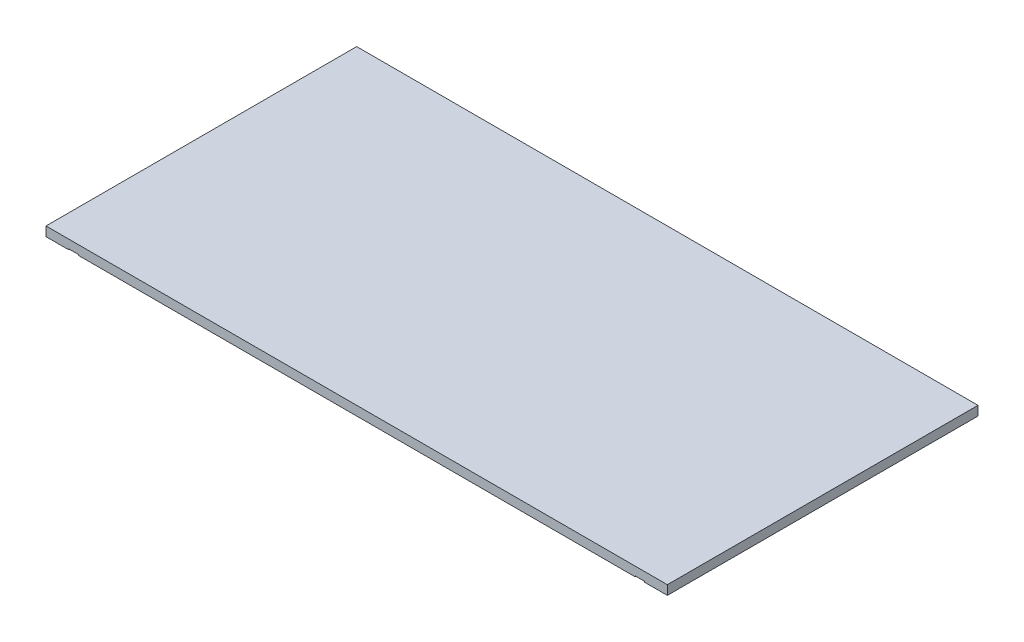
from build123d import *

# Parameters (mm, degrees)
SKETCH1_W           = 1219.2
SKETCH1_H           = 609.6
BOSS_EXTRUDE1_DEPTH = 18.25625
CUT_EXTRUDE1_DEPTH  = 1.5875


with BuildPart() as part:
    # Sketch1 → Boss-Extrude1 (new body)
    with BuildSketch(Plane(origin=(0, 0, 0), x_dir=(1, 0, 0), z_dir=(0, 1, 0))):
        Rectangle(SKETCH1_W, SKETCH1_H)
    extrude(amount=BOSS_EXTRUDE1_DEPTH)

    # Sketch2 → Cut-Extrude1 (cut)
    with BuildSketch(Plane(origin=(0, 0, 0), x_dir=(1, 0, 0), z_dir=(0, 1, 0))):
        Polygon((-565.15, 304.8), (-546.1, 304.8), (-546.1, 9.525), (101.6, 9.525), (101.6, 304.8), (120.65, 304.8), (120.65, 9.525), (546.1, 9.525), (546.1, 304.8), (565.15, 304.8), (565.15, -304.8), (546.1, -304.8), (546.1, -9.525), (120.65, -9.525), (101.6, -9.525), (-101.6, -9.525), (-120.65, -9.525), (-546.1, -9.525), (-546.1, -304.8), (-565.15, -304.8), align=None)
    extrude(amount=CUT_EXTRUDE1_DEPTH, mode=Mode.SUBTRACT)


solid = part.part
